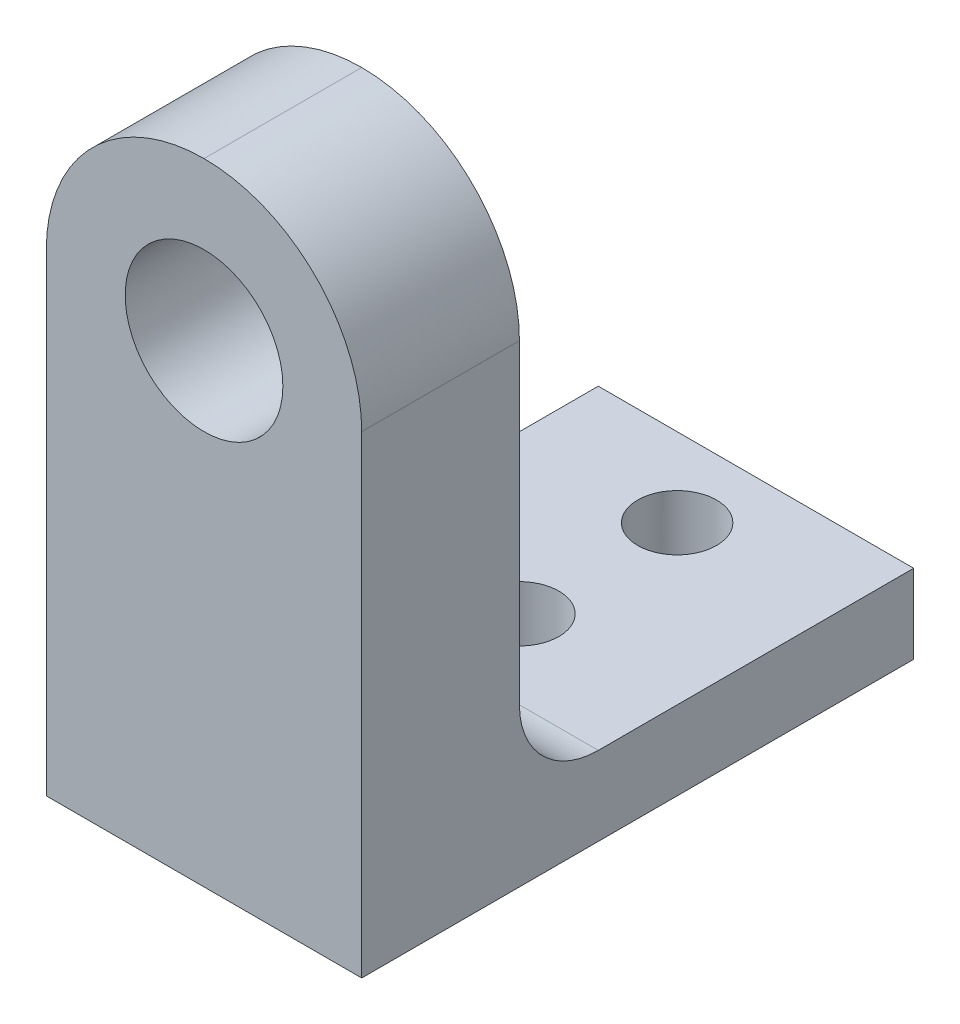
from build123d import *

# Parameters (mm, degrees)
BOSS_EXTRUDE1_DEPTH = 25.4
FILLET1_R           = 12.7
SKETCH2_R           = 6.35
CUT_EXTRUDE1_DEPTH  = 25.4
SKETCH3_R           = 3.175
CUT_EXTRUDE2_DEPTH  = 25.4


with BuildPart() as part:
    # Sketch1 → Boss-Extrude1 (new body)
    with BuildSketch(Plane(origin=(0, 0, 0), x_dir=(0, 0, -1), z_dir=(1, 0, 0))):
        with BuildLine():
            Line((-12.7, 0), (0, 0))
            Line((0, 0), (31.75, 0))
            Line((31.75, 0), (31.75, 6.35))
            Line((31.75, 6.35), (6.35, 6.35))
            ThreePointArc((6.35, 6.35), (1.859871939, 8.209871939), (0, 12.7))
            Line((0, 12.7), (0, 50.8))
            Line((0, 50.8), (-12.7, 50.8))
            Line((-12.7, 50.8), (-12.7, 0))
        make_face()
    extrude(amount=BOSS_EXTRUDE1_DEPTH)

    # Fillet1
    fillet1_edges = [part.edges().sort_by_distance(p)[0] for p in [
        (25.4, 50.8, 6.35),
        (0, 50.8, 6.35),
    ]]
    fillet(fillet1_edges, radius=FILLET1_R - 0.0001)  # a hair under: the kernel refuses the full size

    # Sketch2 → Cut-Extrude1 (cut)
    with BuildSketch(Plane.XY.offset(12.7)):
        with Locations((12.7, 38.1)):
            Circle(SKETCH2_R)
    extrude(amount=-CUT_EXTRUDE1_DEPTH, mode=Mode.SUBTRACT)

    # Sketch3 → Cut-Extrude2 (cut)
    with BuildSketch(Plane(origin=(0, 6.35, 0), x_dir=(1, 0, 0), z_dir=(0, 1, 0))):
        with Locations(Location((12.7, 25.4, 0), (0, 0, 270))):
            Circle(SKETCH3_R)
        with Locations(Location((12.7, 12.7, 0), (0, 0, 270))):
            Circle(SKETCH3_R)
    extrude(amount=-CUT_EXTRUDE2_DEPTH, mode=Mode.SUBTRACT)


solid = part.part
